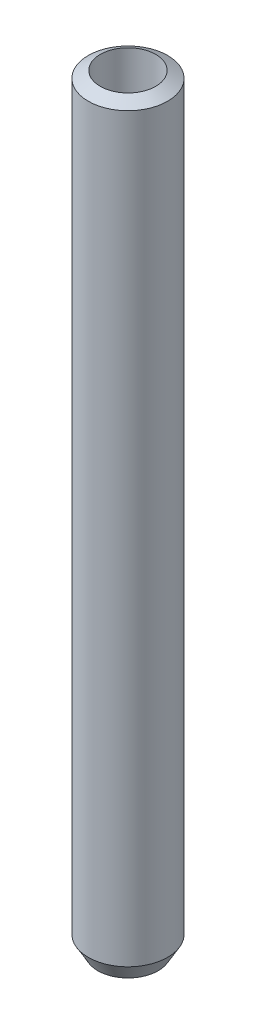
from build123d import *

# Parameters (mm, degrees)
SKETCH1_R           = 10
BOSS_EXTRUDE1_DEPTH = 193.380027
SKETCH2_R           = 6.984860876
CUT_EXTRUDE1_DEPTH  = 194.896453919
CHAMFER1_SIZE       = 2.383103
CHAMFER1_SIZE_2     = 4.127655


with BuildPart() as part:
    # Sketch1 → Boss-Extrude1 (new body)
    with BuildSketch(Plane(origin=(0, 0, 0), x_dir=(1, 0, 0), z_dir=(0, 1, 0))):
        with Locations(Location((0, 0, 0), (0, 0, 270))):
            Circle(SKETCH1_R)
    extrude(amount=BOSS_EXTRUDE1_DEPTH)

    # Sketch2 → Cut-Extrude1 (cut, through all)
    with BuildSketch(Plane(origin=(0, 0, 0), x_dir=(1, 0, 0), z_dir=(0, 1, 0))):
        with Locations(Location((0, 0, 0), (0, 0, 270))):
            Circle(SKETCH2_R)
    extrude(amount=CUT_EXTRUDE1_DEPTH, mode=Mode.SUBTRACT)

    # Chamfer1
    # the kernel refuses this chamfer: 4.127655, 2.383103 mm, written as the material it takes off along each edge
    with BuildSketch(Plane(origin=(0, 193.380027, 0), x_dir=(0, 0, 1), z_dir=(-1, 0, 0))) as chamfer1_piece_1:
        Polygon((10, -CHAMFER1_SIZE), (10 - CHAMFER1_SIZE_2, 0), (10, 0), align=None)
    revolve(axis=Axis((0, 193.380027, 0), (0, 1, 0)), mode=Mode.SUBTRACT)
    with BuildSketch(Plane(origin=(0, 0, 0), x_dir=(0, 0, 1), z_dir=(-1, 0, 0))) as chamfer1_piece_2:
        Polygon((10, CHAMFER1_SIZE_2), (10 - CHAMFER1_SIZE, 0), (10, 0), align=None)
    revolve(axis=Axis((0, 0, 0), (0, 1, 0)), mode=Mode.SUBTRACT)


solid = part.part
